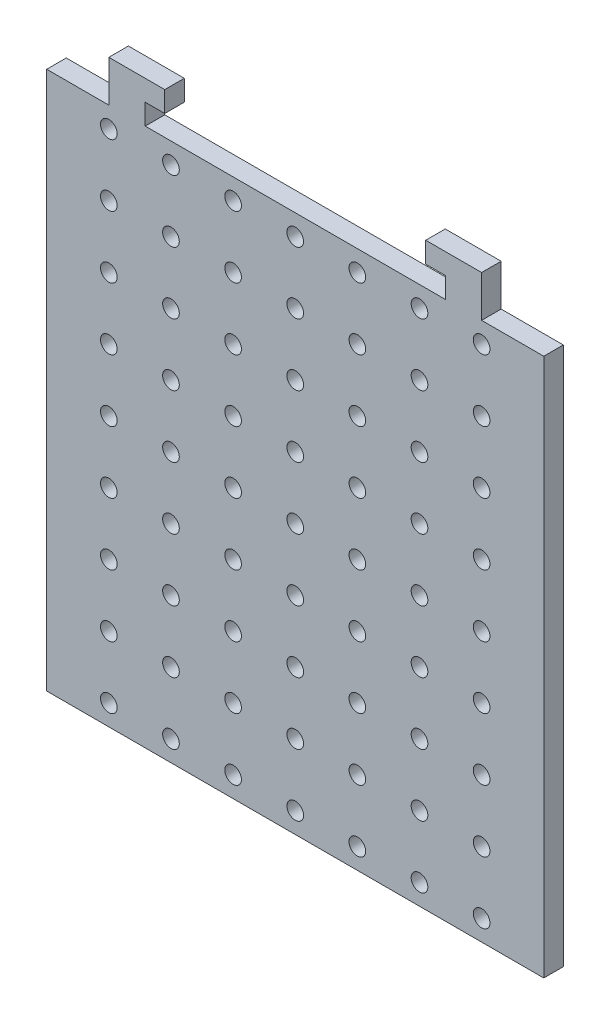
from build123d import *

# Parameters (mm, degrees)
BOSS_EXTRUDE2_DEPTH     = 5.9944
F_1_4_20_TAPPED_HOLE1_D = 5.1054
FILL_START              = -5.9944
FILL_PATTERN1_OUTLINE_R = 2.5527
FILL_PATTERN1_DEPTH     = 5.9944


# Read off the part's stored shape, not the designer's step: Fill Pattern1
with BuildPart() as part:
    # Sketch1 → Boss-Extrude2 (new body)
    with BuildSketch(Plane.XY):
        Polygon((0, 0), (152.4, 0), (152.4, 165.1), (133.35, 165.1), (133.35, 177.8), (116.205, 177.8), (116.205, 171.45), (122.1994, 171.45), (122.1994, 165.1), (30.2006, 165.1), (30.2006, 171.45), (36.195, 171.45), (36.195, 177.8), (19.05, 177.8), (19.05, 165.1), (0, 165.1), align=None)
    extrude(amount=-BOSS_EXTRUDE2_DEPTH)

    # 1/4-20 Tapped Hole1 (through all)
    with Locations(Plane.XY):
        with Locations((76.2, 82.55)):
            Hole(F_1_4_20_TAPPED_HOLE1_D / 2)

    # Fill Pattern1 outline → Fill Pattern1 (cut)
    with BuildSketch(Plane.XY.offset(FILL_START)):
        with Locations((95.25, 63.5)):
            Circle(FILL_PATTERN1_OUTLINE_R)
        with Locations((76.2, 63.5)):
            Circle(FILL_PATTERN1_OUTLINE_R)
        with Locations((57.15, 63.5)):
            Circle(FILL_PATTERN1_OUTLINE_R)
        with Locations((57.15, 82.55)):
            Circle(FILL_PATTERN1_OUTLINE_R)
        with Locations((57.15, 101.6)):
            Circle(FILL_PATTERN1_OUTLINE_R)
        with Locations((76.2, 101.6)):
            Circle(FILL_PATTERN1_OUTLINE_R)
        with Locations((95.25, 101.6)):
            Circle(FILL_PATTERN1_OUTLINE_R)
        with Locations((95.25, 82.55)):
            Circle(FILL_PATTERN1_OUTLINE_R)
        with Locations((114.3, 44.45)):
            Circle(FILL_PATTERN1_OUTLINE_R)
        with Locations((95.25, 44.45)):
            Circle(FILL_PATTERN1_OUTLINE_R)
        with Locations((76.2, 44.45)):
            Circle(FILL_PATTERN1_OUTLINE_R)
        with Locations((57.15, 44.45)):
            Circle(FILL_PATTERN1_OUTLINE_R)
        with Locations((38.1, 44.45)):
            Circle(FILL_PATTERN1_OUTLINE_R)
        with Locations((38.1, 63.5)):
            Circle(FILL_PATTERN1_OUTLINE_R)
        with Locations((38.1, 82.55)):
            Circle(FILL_PATTERN1_OUTLINE_R)
        with Locations((38.1, 101.6)):
            Circle(FILL_PATTERN1_OUTLINE_R)
        with Locations((38.1, 120.65)):
            Circle(FILL_PATTERN1_OUTLINE_R)
        with Locations((57.15, 120.65)):
            Circle(FILL_PATTERN1_OUTLINE_R)
        with Locations((76.2, 120.65)):
            Circle(FILL_PATTERN1_OUTLINE_R)
        with Locations((95.25, 120.65)):
            Circle(FILL_PATTERN1_OUTLINE_R)
        with Locations((114.3, 120.65)):
            Circle(FILL_PATTERN1_OUTLINE_R)
        with Locations((114.3, 101.6)):
            Circle(FILL_PATTERN1_OUTLINE_R)
        with Locations((114.3, 82.55)):
            Circle(FILL_PATTERN1_OUTLINE_R)
        with Locations((114.3, 63.5)):
            Circle(FILL_PATTERN1_OUTLINE_R)
        with Locations((133.35, 25.4)):
            Circle(FILL_PATTERN1_OUTLINE_R)
        with Locations((114.3, 25.4)):
            Circle(FILL_PATTERN1_OUTLINE_R)
        with Locations((95.25, 25.4)):
            Circle(FILL_PATTERN1_OUTLINE_R)
        with Locations((76.2, 25.4)):
            Circle(FILL_PATTERN1_OUTLINE_R)
        with Locations((57.15, 25.4)):
            Circle(FILL_PATTERN1_OUTLINE_R)
        with Locations((38.1, 25.4)):
            Circle(FILL_PATTERN1_OUTLINE_R)
        with Locations((19.05, 25.4)):
            Circle(FILL_PATTERN1_OUTLINE_R)
        with Locations((19.05, 44.45)):
            Circle(FILL_PATTERN1_OUTLINE_R)
        with Locations((19.05, 63.5)):
            Circle(FILL_PATTERN1_OUTLINE_R)
        with Locations((19.05, 82.55)):
            Circle(FILL_PATTERN1_OUTLINE_R)
        with Locations((19.05, 101.6)):
            Circle(FILL_PATTERN1_OUTLINE_R)
        with Locations((19.05, 120.65)):
            Circle(FILL_PATTERN1_OUTLINE_R)
        with Locations((19.05, 139.7)):
            Circle(FILL_PATTERN1_OUTLINE_R)
        with Locations((38.1, 139.7)):
            Circle(FILL_PATTERN1_OUTLINE_R)
        with Locations((57.15, 139.7)):
            Circle(FILL_PATTERN1_OUTLINE_R)
        with Locations((76.2, 139.7)):
            Circle(FILL_PATTERN1_OUTLINE_R)
        with Locations((95.25, 139.7)):
            Circle(FILL_PATTERN1_OUTLINE_R)
        with Locations((114.3, 139.7)):
            Circle(FILL_PATTERN1_OUTLINE_R)
        with Locations((133.35, 139.7)):
            Circle(FILL_PATTERN1_OUTLINE_R)
        with Locations((133.35, 120.65)):
            Circle(FILL_PATTERN1_OUTLINE_R)
        with Locations((133.35, 101.6)):
            Circle(FILL_PATTERN1_OUTLINE_R)
        with Locations((133.35, 82.55)):
            Circle(FILL_PATTERN1_OUTLINE_R)
        with Locations((133.35, 63.5)):
            Circle(FILL_PATTERN1_OUTLINE_R)
        with Locations((133.35, 44.45)):
            Circle(FILL_PATTERN1_OUTLINE_R)
        with Locations((133.35, 6.35)):
            Circle(FILL_PATTERN1_OUTLINE_R)
        with Locations((114.3, 6.35)):
            Circle(FILL_PATTERN1_OUTLINE_R)
        with Locations((95.25, 6.35)):
            Circle(FILL_PATTERN1_OUTLINE_R)
        with Locations((76.2, 6.35)):
            Circle(FILL_PATTERN1_OUTLINE_R)
        with Locations((57.15, 6.35)):
            Circle(FILL_PATTERN1_OUTLINE_R)
        with Locations((38.1, 6.35)):
            Circle(FILL_PATTERN1_OUTLINE_R)
        with Locations((19.05, 6.35)):
            Circle(FILL_PATTERN1_OUTLINE_R)
        with Locations((19.05, 158.75)):
            Circle(FILL_PATTERN1_OUTLINE_R)
        with Locations((38.1, 158.75)):
            Circle(FILL_PATTERN1_OUTLINE_R)
        with Locations((57.15, 158.75)):
            Circle(FILL_PATTERN1_OUTLINE_R)
        with Locations((76.2, 158.75)):
            Circle(FILL_PATTERN1_OUTLINE_R)
        with Locations((95.25, 158.75)):
            Circle(FILL_PATTERN1_OUTLINE_R)
        with Locations((114.3, 158.75)):
            Circle(FILL_PATTERN1_OUTLINE_R)
        with Locations((133.35, 158.75)):
            Circle(FILL_PATTERN1_OUTLINE_R)
    extrude(amount=FILL_PATTERN1_DEPTH, mode=Mode.SUBTRACT)


solid = part.part
